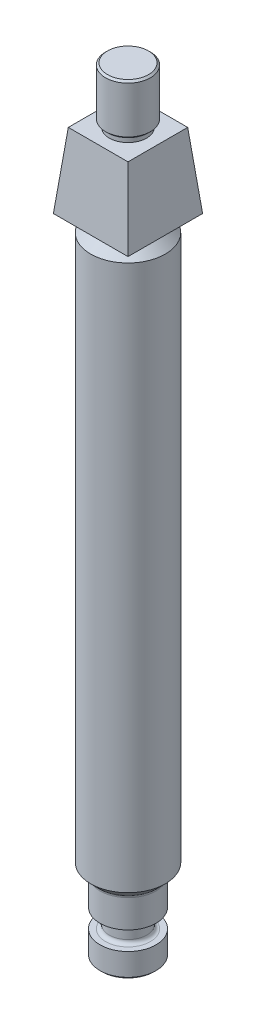
from build123d import *

# Parameters (mm, degrees)
SKETCH1_R           = 15
BOSS_EXTRUDE1_DEPTH = 40
SKETCH2_R           = 20
BOSS_EXTRUDE2_DEPTH = 300
SKETCH4_W           = 5
SKETCH4_H           = 10
SKETCH3_R           = 15
BOSS_EXTRUDE3_DEPTH = 5
SKETCH7_R           = 10
BOSS_EXTRUDE4_DEPTH = 3
SKETCH8_R           = 12
BOSS_EXTRUDE5_DEPTH = 27
CHAMFER1_SIZE       = 1
FILLET1_R           = 2
CHAMFER2_SIZE       = 1


with BuildPart() as part:
    # Sketch1 → Boss-Extrude1 (new body)
    with BuildSketch(Plane(origin=(0, 0, 0), x_dir=(1, 0, 0), z_dir=(0, 1, 0))):
        Circle(SKETCH1_R)
    extrude(amount=BOSS_EXTRUDE1_DEPTH)

    # Sketch2 → Boss-Extrude2 (add)
    with BuildSketch(Plane(origin=(0, 40, 0), x_dir=(1, 0, 0), z_dir=(0, 1, 0))):
        Circle(SKETCH2_R)
    extrude(amount=BOSS_EXTRUDE2_DEPTH)

    # Sketch4 → Cut-Revolve1 (revolve, cut)
    with BuildSketch(Plane.XY):
        with Locations((-12.5, 18)):
            Rectangle(SKETCH4_W, SKETCH4_H)
    revolve(axis=Axis((0, 40, 0), (0, -1, 0)), mode=Mode.SUBTRACT)

    # Sketch3 → Boss-Extrude3 (add)
    with BuildSketch(Plane(origin=(0, 340, 0), x_dir=(1, 0, 0), z_dir=(0, 1, 0))):
        Circle(SKETCH3_R)
    extrude(amount=BOSS_EXTRUDE3_DEPTH)

    # Sketch5 → Loft1 section 0
    with BuildSketch(Plane(origin=(0, 345, 0), x_dir=(1, 0, 0), z_dir=(0, 1, 0))):
        with BuildLine():
            Line((20, -20), (-20, -20))
            Line((-20, -20), (-20, 20))
            Line((-20, 20), (20, 20))
            Line((20, 20), (20, -20))
        make_face()
    # Sketch6 → Loft1 section 1
    with BuildSketch(Plane(origin=(0, 385, 0), x_dir=(1, 0, 0), z_dir=(0, 1, 0))):
        with BuildLine():
            Line((16, -16), (-16, -16))
            Line((-16, -16), (-16, 16))
            Line((-16, 16), (16, 16))
            Line((16, 16), (16, -16))
        make_face()
    loft()

    # Sketch7 → Boss-Extrude4 (add)
    with BuildSketch(Plane(origin=(0, 385, 0), x_dir=(1, 0, 0), z_dir=(0, 1, 0))):
        Circle(SKETCH7_R)
    extrude(amount=BOSS_EXTRUDE4_DEPTH)

    # Sketch8 → Boss-Extrude5 (add)
    with BuildSketch(Plane(origin=(0, 388, 0), x_dir=(1, 0, 0), z_dir=(0, 1, 0))):
        Circle(SKETCH8_R)
    extrude(amount=BOSS_EXTRUDE5_DEPTH)

    # Chamfer1
    chamfer1_edges = [part.edges().sort_by_distance(p)[0] for p in [
        (-12, 388, 0),
        (-12, 415, 0),
    ]]
    chamfer(chamfer1_edges, length=CHAMFER1_SIZE)

    # Fillet1
    fillet1_edges = [part.edges().sort_by_distance(p)[0] for p in [
        (-15, 340, 0),
        (-15, 345, 0),
        (10, 13, 0),
        (10, 23, 0),
        (-15, 40, 0),
    ]]
    fillet(fillet1_edges, radius=FILLET1_R)

    # Chamfer2
    chamfer2_edges = [part.edges().sort_by_distance(p)[0] for p in [
        (-15, 0, 0),
    ]]
    chamfer(chamfer2_edges, length=CHAMFER2_SIZE)

    # Sketch9 → Cut-Revolve2 (revolve, cut)
    with BuildSketch(Plane.XY):
        Polygon((-20, 336.171572875), (-20, 340), (-15.585786438, 340.585786438), align=None)
        Polygon((-20, 43.828427125), (-20, 40), (-15.585786438, 39.414213562), align=None)
    revolve(axis=Axis((0, 340, 0), (0, -1, 0)), mode=Mode.SUBTRACT)


solid = part.part
